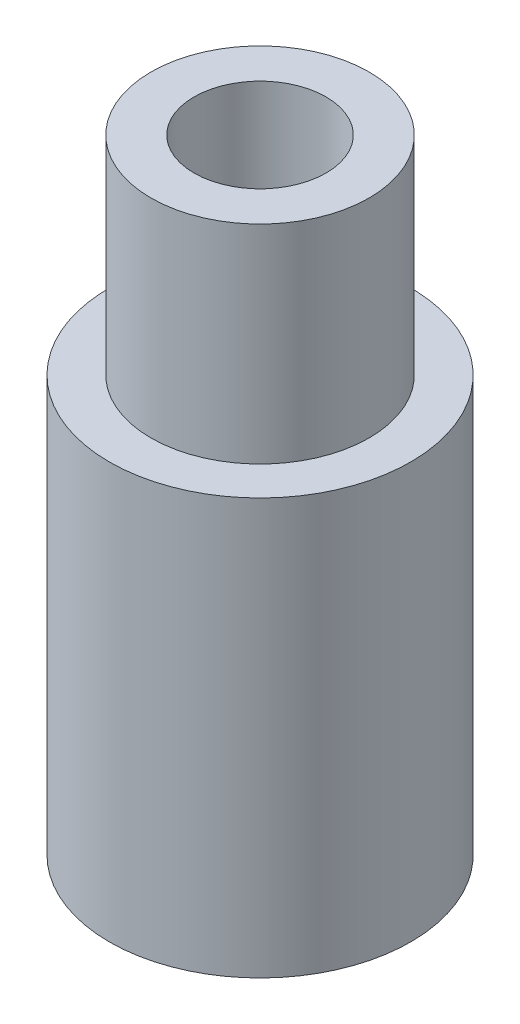
from build123d import *

# Parameters (mm, degrees)
SKETCH1_R           = 7.25
SKETCH1_R_2         = 3.175
BOSS_EXTRUDE1_DEPTH = 30
SKETCH2_OUTSIDE_W   = 23.768
SKETCH2_OUTSIDE_H   = 23.768
SKETCH2_OUTSIDE_R   = 5.25
CUT_EXTRUDE1_DEPTH  = 10
CUT_EXTRUDE2_START  = -9
SKETCH3_R           = 5.25
CUT_EXTRUDE2_DEPTH  = 9


with BuildPart() as part:
    # Sketch1 → Boss-Extrude1 (new body)
    with BuildSketch(Plane(origin=(0, 0, 0), x_dir=(1, 0, 0), z_dir=(0, 1, 0))):
        Circle(SKETCH1_R)
        Circle(SKETCH1_R_2, mode=Mode.SUBTRACT)
    extrude(amount=BOSS_EXTRUDE1_DEPTH)

    # Sketch2 outside → Cut-Extrude1 (cut)
    with BuildSketch(Plane(origin=(0, 30, 0), x_dir=(1, 0, 0), z_dir=(0, 1, 0))):
        Rectangle(SKETCH2_OUTSIDE_W, SKETCH2_OUTSIDE_H)
        Circle(SKETCH2_OUTSIDE_R, mode=Mode.SUBTRACT)
    extrude(amount=-CUT_EXTRUDE1_DEPTH, mode=Mode.SUBTRACT)

    # Sketch3 → Cut-Extrude2 (cut)
    with BuildSketch(Plane.XZ.offset(CUT_EXTRUDE2_START)):
        Circle(SKETCH3_R)
    extrude(amount=CUT_EXTRUDE2_DEPTH, mode=Mode.SUBTRACT)


solid = part.part
